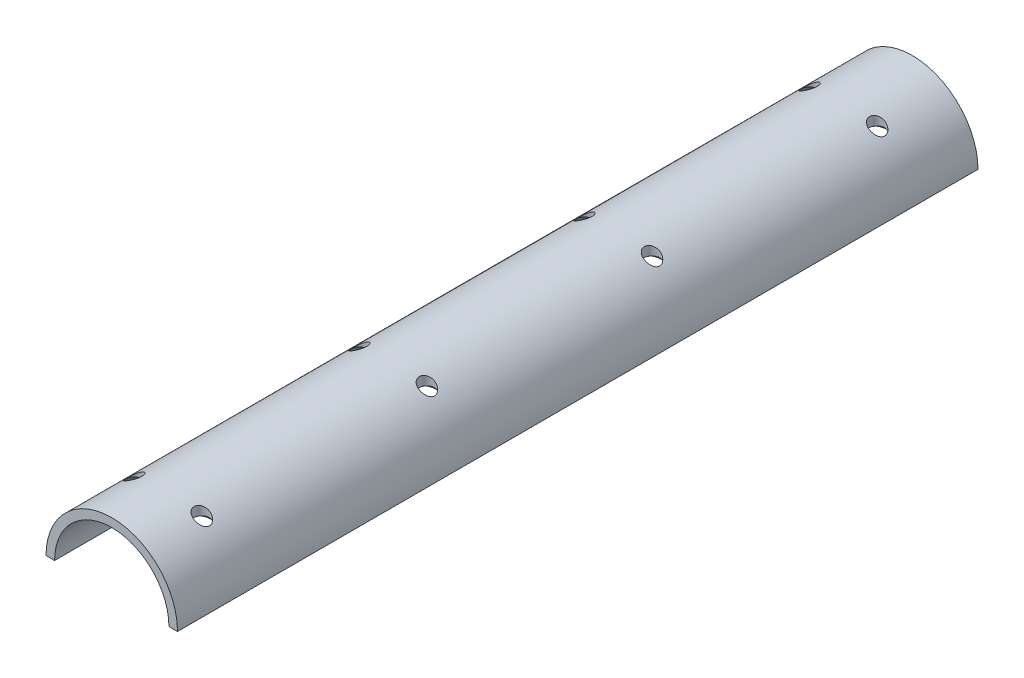
from build123d import *

# Parameters (mm, degrees)
SKETCH2_R                                     = 29.21
BOSS_EXTRUDE1_DEPTH                           = 355.6
SKETCH3_R                                     = 25.4
CUT_EXTRUDE1_DEPTH                            = 358.99135213
CUT_EXTRUDE2_REACH                            = 359.991
SKETCH4_W                                     = 58.42
SKETCH4_H                                     = 355.6
CSK_FOR_1_4_FLAT_HEAD_MACHINE_SCREW1_AT_COUNT = 2
CSK_FOR_1_4_FLAT_HEAD_MACHINE_SCREW1_AT_PITCH = 30
CSK_FOR_1_4_FLAT_HEAD_MACHINE_SCREW1_2_COUNT  = 2
CSK_FOR_1_4_FLAT_HEAD_MACHINE_SCREW1_2_PITCH  = 100
CSK_FOR_1_4_FLAT_HEAD_MACHINE_SCREW1_3_COUNT  = 2
CSK_FOR_1_4_FLAT_HEAD_MACHINE_SCREW1_3_PITCH  = 104.403065089
CSK_FOR_1_4_FLAT_HEAD_MACHINE_SCREW1_4_COUNT  = 2
CSK_FOR_1_4_FLAT_HEAD_MACHINE_SCREW1_4_PITCH  = 200
CSK_FOR_1_4_FLAT_HEAD_MACHINE_SCREW1_5_COUNT  = 2
CSK_FOR_1_4_FLAT_HEAD_MACHINE_SCREW1_5_PITCH  = 202.237484162
CSK_FOR_1_4_FLAT_HEAD_MACHINE_SCREW1_6_COUNT  = 2
CSK_FOR_1_4_FLAT_HEAD_MACHINE_SCREW1_6_PITCH  = 300
CSK_FOR_1_4_FLAT_HEAD_MACHINE_SCREW1_7_COUNT  = 2
CSK_FOR_1_4_FLAT_HEAD_MACHINE_SCREW1_7_PITCH  = 301.496268634


with BuildPart() as part:
    # Sketch2 → Boss-Extrude1 (new body)
    with BuildSketch(Plane.XY):
        Circle(SKETCH2_R)
    extrude(amount=-BOSS_EXTRUDE1_DEPTH)

    # Sketch3 → Cut-Extrude1 (cut, through all)
    with BuildSketch(Plane.XY):
        Circle(SKETCH3_R)
    extrude(amount=-CUT_EXTRUDE1_DEPTH, mode=Mode.SUBTRACT)

    # Sketch4 → Cut-Extrude2 (cut, up to next)
    with BuildSketch(Plane(origin=(0, 0, 0), x_dir=(1, 0, 0), z_dir=(0, 1, 0)), mode=Mode.PRIVATE) as cut_extrude2_sk1:
        with Locations((0, 177.8)):
            Rectangle(SKETCH4_W, SKETCH4_H)
    cut_extrude2_tool1 = extrude(cut_extrude2_sk1.sketch, amount=-CUT_EXTRUDE2_REACH, mode=Mode.PRIVATE) & part.part
    add(cut_extrude2_tool1.solids().sort_by_distance((0, 0, -177.8))[0], mode=Mode.SUBTRACT)

    # Sketch10 → CSK for 1/4 Flat Head Machine Screw1 (revolve, cut)
    with BuildSketch(Plane(origin=(15, 0, -25), x_dir=(0, 0, -1), z_dir=(1, 0, 0))):
        Polygon((0, 0), (0, 29.21), (3.3782, 29.21), (3.3782, 22.520932584), (6.4389, 19), (6.4389, 0), align=None)
    csk_for_1_4_flat_head_machine_screw1 = revolve(axis=Axis((15, -6.35, -25), (0, 1, 0)), mode=Mode.SUBTRACT)

    # CSK for 1/4 Flat Head Machine Screw1 at: CSK for 1/4 Flat Head Machine Screw1 ×2
    with Locations(*[(-i * CSK_FOR_1_4_FLAT_HEAD_MACHINE_SCREW1_AT_PITCH, 0, 0) for i in range(1, CSK_FOR_1_4_FLAT_HEAD_MACHINE_SCREW1_AT_COUNT)]):
        add(csk_for_1_4_flat_head_machine_screw1, mode=Mode.SUBTRACT)

    # CSK for 1_4 Flat Head Machine Screw1 2: CSK for 1/4 Flat Head Machine Screw1 ×2
    with Locations(*[(0, 0, -i * CSK_FOR_1_4_FLAT_HEAD_MACHINE_SCREW1_2_PITCH) for i in range(1, CSK_FOR_1_4_FLAT_HEAD_MACHINE_SCREW1_2_COUNT)]):
        add(csk_for_1_4_flat_head_machine_screw1, mode=Mode.SUBTRACT)

    # CSK for 1_4 Flat Head Machine Screw1 3: CSK for 1/4 Flat Head Machine Screw1 ×2
    with Locations(*[Vector(-0.2873478855663454, 0, -0.9578262852211514) * (i * CSK_FOR_1_4_FLAT_HEAD_MACHINE_SCREW1_3_PITCH) for i in range(1, CSK_FOR_1_4_FLAT_HEAD_MACHINE_SCREW1_3_COUNT)]):
        add(csk_for_1_4_flat_head_machine_screw1, mode=Mode.SUBTRACT)

    # CSK for 1_4 Flat Head Machine Screw1 4: CSK for 1/4 Flat Head Machine Screw1 ×2
    with Locations(*[(0, 0, -i * CSK_FOR_1_4_FLAT_HEAD_MACHINE_SCREW1_4_PITCH) for i in range(1, CSK_FOR_1_4_FLAT_HEAD_MACHINE_SCREW1_4_COUNT)]):
        add(csk_for_1_4_flat_head_machine_screw1, mode=Mode.SUBTRACT)

    # CSK for 1_4 Flat Head Machine Screw1 5: CSK for 1/4 Flat Head Machine Screw1 ×2
    with Locations(*[Vector(-0.14834045293024462, 0, -0.9889363528682976) * (i * CSK_FOR_1_4_FLAT_HEAD_MACHINE_SCREW1_5_PITCH) for i in range(1, CSK_FOR_1_4_FLAT_HEAD_MACHINE_SCREW1_5_COUNT)]):
        add(csk_for_1_4_flat_head_machine_screw1, mode=Mode.SUBTRACT)

    # CSK for 1_4 Flat Head Machine Screw1 6: CSK for 1/4 Flat Head Machine Screw1 ×2
    with Locations(*[(0, 0, -i * CSK_FOR_1_4_FLAT_HEAD_MACHINE_SCREW1_6_PITCH) for i in range(1, CSK_FOR_1_4_FLAT_HEAD_MACHINE_SCREW1_6_COUNT)]):
        add(csk_for_1_4_flat_head_machine_screw1, mode=Mode.SUBTRACT)

    # CSK for 1_4 Flat Head Machine Screw1 7: CSK for 1/4 Flat Head Machine Screw1 ×2
    with Locations(*[Vector(-0.09950371902099887, 0, -0.9950371902099892) * (i * CSK_FOR_1_4_FLAT_HEAD_MACHINE_SCREW1_7_PITCH) for i in range(1, CSK_FOR_1_4_FLAT_HEAD_MACHINE_SCREW1_7_COUNT)]):
        add(csk_for_1_4_flat_head_machine_screw1, mode=Mode.SUBTRACT)


solid = part.part
